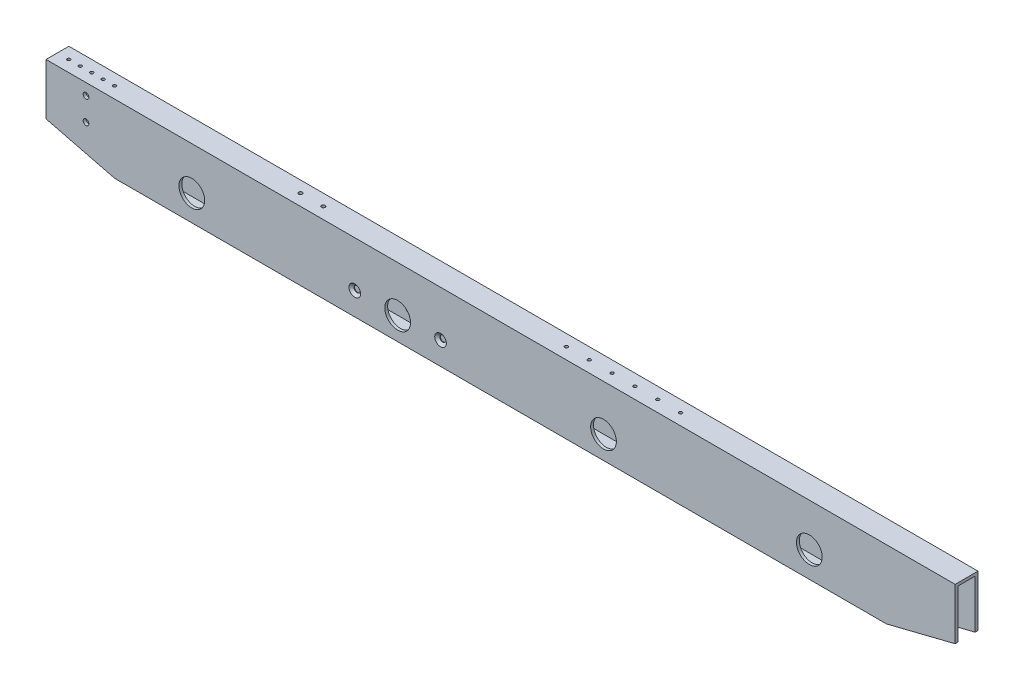
from build123d import *

# Parameters (mm, degrees)
SKETCH1_W                                           = 1009.65
SKETCH1_H                                           = 76.2
SKETCH1_R                                           = 14.2875
BOSS_EXTRUDE2_DEPTH                                 = 12.7
SKETCH3_W                                           = 19.05
SKETCH3_H                                           = 69.85
CUT_EXTRUDE2_DEPTH                                  = 1011.448426442
CUT_EXTRUDE3_DEPTH                                  = 507.897475457
SKETCH9_R                                           = 1.7272
CUT_EXTRUDE5_DEPTH                                  = 6.35
SKETCH12_R                                          = 1.7272
CUT_EXTRUDE8_DEPTH                                  = 5.08
CSK_FOR_1_4_FLAT_HEAD_MACHINE_SCREW_100_D           = 6.7564
CSK_FOR_1_4_FLAT_HEAD_MACHINE_SCREW_100_CSINK_D     = 12.8778
CSK_FOR_1_4_FLAT_HEAD_MACHINE_SCREW_100_CSINK_ANGLE = 100
CUT_EXTRUDE9_START                                  = -6.35
SKETCH15_R                                          = 1.7272
CUT_EXTRUDE9_DEPTH                                  = 6.35
SKETCH16_R                                          = 17.4625
CUT_EXTRUDE10_DEPTH                                 = 3.81
F_1_4_0_25_DIAMETER_HOLE1_D                         = 6.35
F_10_32_TAPPED_HOLE3_D                              = 4.0386


with BuildPart() as part:
    # Sketch1 → Boss-Extrude2 (new, symmetric)
    with BuildSketch(Plane.XY):
        Rectangle(SKETCH1_W, SKETCH1_H)
        with Locations((114.3, -12.7)):
            Circle(SKETCH1_R, mode=Mode.SUBTRACT)
        with Locations((-342.9, -9.525)):
            Circle(SKETCH1_R, mode=Mode.SUBTRACT)
        with Locations((342.9, -9.525)):
            Circle(SKETCH1_R, mode=Mode.SUBTRACT)
        with Locations((-114.3, -12.7)):
            Circle(SKETCH1_R, mode=Mode.SUBTRACT)
    extrude(amount=BOSS_EXTRUDE2_DEPTH, both=True)

    # Sketch3 → Cut-Extrude2 (cut, through all)
    with BuildSketch(Plane(origin=(504.825, 0, 0), x_dir=(0, 0, -1), z_dir=(1, 0, 0))):
        Rectangle(SKETCH3_W, SKETCH3_H)
    extrude(amount=-CUT_EXTRUDE2_DEPTH, mode=Mode.SUBTRACT)

    # Sketch4 → Cut-Extrude3 (cut, through all)
    with BuildSketch(Plane.XY.offset(12.7)):
        Polygon((-504.825, -38.1), (-504.825, -19.05), (-428.625, -38.1), align=None)
        Polygon((428.625, -38.1), (504.825, -38.1), (504.825, -19.05), align=None)
    extrude(amount=-CUT_EXTRUDE3_DEPTH, mode=Mode.SUBTRACT)

    # Sketch9 → Cut-Extrude5 (cut)
    with BuildSketch(Plane(origin=(0, 38.1, 0), x_dir=(1, 0, 0), z_dir=(0, 1, 0))):
        with Locations((-492.125, 0)):
            Circle(SKETCH9_R)
        with Locations((-441.325, 0)):
            Circle(SKETCH9_R)
        with Locations((-479.425, 0)):
            Circle(SKETCH9_R)
        with Locations((-466.725, 0)):
            Circle(SKETCH9_R)
        with Locations((-454.025, 0)):
            Circle(SKETCH9_R)
    extrude(amount=-CUT_EXTRUDE5_DEPTH, mode=Mode.SUBTRACT)

    # Sketch12 → Cut-Extrude8 (cut)
    with BuildSketch(Plane(origin=(0, 38.1, 0), x_dir=(1, 0, 0), z_dir=(0, 1, 0))):
        with Locations((187.325, 0)):
            Circle(SKETCH12_R)
        with Locations((161.925, 0)):
            Circle(SKETCH12_R)
        with Locations((136.525, 0)):
            Circle(SKETCH12_R)
        with Locations((111.125, 0)):
            Circle(SKETCH12_R)
        with Locations((85.725, 0)):
            Circle(SKETCH12_R)
        with Locations((60.325, 0)):
            Circle(SKETCH12_R)
    extrude(amount=-CUT_EXTRUDE8_DEPTH, mode=Mode.SUBTRACT)

    # CSK for 1/4 Flat Head Machine Screw (100)1 (through all)
    with Locations(Plane.XY.offset(12.7)):
        with Locations((-66.675, -12.7), (-161.925, -12.7)):
            CounterSinkHole(CSK_FOR_1_4_FLAT_HEAD_MACHINE_SCREW_100_D / 2, CSK_FOR_1_4_FLAT_HEAD_MACHINE_SCREW_100_CSINK_D / 2, counter_sink_angle=CSK_FOR_1_4_FLAT_HEAD_MACHINE_SCREW_100_CSINK_ANGLE)

    # Sketch15 → Cut-Extrude9 (cut)
    with BuildSketch(Plane(origin=(0, -38.1, 0), x_dir=(-1, 0, 0), z_dir=(0, -1, 0)).offset(CUT_EXTRUDE9_START)):
        with Locations((396.875, 0)):
            Circle(SKETCH15_R)
        with Locations((320.675, 0)):
            Circle(SKETCH15_R)
        with Locations((244.475, 0)):
            Circle(SKETCH15_R)
        with Locations((168.275, 0)):
            Circle(SKETCH15_R)
        with Locations((92.075, 0)):
            Circle(SKETCH15_R)
        with Locations((15.875, 0)):
            Circle(SKETCH15_R)
        with Locations((-60.325, 0)):
            Circle(SKETCH15_R)
    extrude(amount=CUT_EXTRUDE9_DEPTH, mode=Mode.SUBTRACT)

    # Sketch16 → Cut-Extrude10 (cut)
    with BuildSketch(Plane(origin=(0, 0, -12.7), x_dir=(-1, 0, 0), z_dir=(0, 0, -1))):
        with Locations((114.3, -12.7)):
            Circle(SKETCH16_R)
    extrude(amount=-CUT_EXTRUDE10_DEPTH, mode=Mode.SUBTRACT)

    # 1/4 (0.25) Diameter Hole1 (through all)
    with Locations(Plane.XY.offset(12.7)):
        with Locations((-460.375, 25.4), (-460.375, 0)):
            Hole(F_1_4_0_25_DIAMETER_HOLE1_D / 2)

    # #10-32 Tapped Hole3 (through all)
    with Locations(Plane(origin=(0, 38.1, 0), x_dir=(1, 0, 0), z_dir=(0, 1, 0))):
        with Locations((-234.95, 0), (-209.55, 0)):
            Hole(F_10_32_TAPPED_HOLE3_D / 2)


solid = part.part
